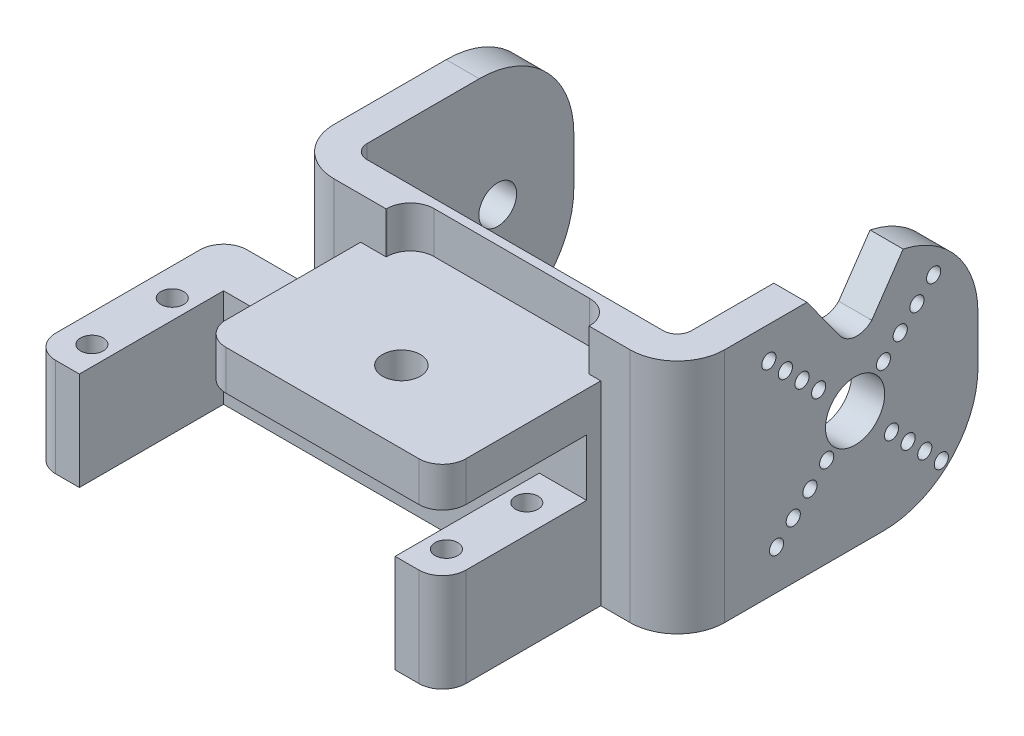
from build123d import *

# Parameters (mm, degrees)
BOSS_EXTRUDE1_DEPTH     = 50
BOSS_EXTRUDE2_DEPTH     = 20.8
SKETCH4_W               = 50.8
SKETCH4_H               = 3
BOSS_EXTRUDE3_DEPTH     = 20.4
BOSS_EXTRUDE4_START     = 32.8
BOSS_EXTRUDE4_OUTLINE_W = 50.8
BOSS_EXTRUDE4_OUTLINE_H = 30.5
BOSS_EXTRUDE4_OUTLINE_R = 4
BOSS_EXTRUDE4_DEPTH     = 8.4
CUT_EXTRUDE1_OUTLINE_R  = 2.4
CUT_EXTRUDE1_DEPTH      = 20.8
FILLET1_R               = 5
FILLET2_R               = 20
SKETCH6_R               = 1.5
CUT_EXTRUDE2_DEPTH      = 28.4
CUT_EXTRUDE3_DEPTH      = 136.4
CUT_EXTRUDE4_DEPTH      = 132.215666798
CUT_EXTRUDE4_DEPTH_BACK = 26.4
CUT_EXTRUDE5_DEPTH      = 8.8


# Read off the part's stored shape, not the designer's step: Boss-Extrude4, Cut-Extrude1
with BuildPart() as part:
    # Sketch1 → Boss-Extrude1 (new body)
    with BuildSketch(Plane(origin=(0, 0, 0), x_dir=(1, 0, 0), z_dir=(0, 1, 0))):
        with BuildLine():
            Line((-56.375697839, 54.197981352), (-56.375697839, 10.497981352))
            ThreePointArc((-56.375697839, 10.497981352), (-53.44676565, 3.42691354), (-46.375697839, 0.497981352))
            Line((-46.375697839, 0.497981352), (16.224302161, 0.497981352))
            ThreePointArc((16.224302161, 0.497981352), (23.295369973, 3.42691354), (26.224302161, 10.497981352))
            Line((26.224302161, 10.497981352), (26.224302161, 64.097981352))
            Line((26.224302161, 64.097981352), (19.224302161, 64.097981352))
            Line((19.224302161, 64.097981352), (19.224302161, 10.497981352))
            ThreePointArc((19.224302161, 10.497981352), (18.345622505, 8.376661008), (16.224302161, 7.497981352))
            Line((16.224302161, 7.497981352), (-46.375697839, 7.497981352))
            ThreePointArc((-46.375697839, 7.497981352), (-48.497018182, 8.376661008), (-49.375697839, 10.497981352))
            Line((-49.375697839, 10.497981352), (-49.375697839, 54.197981352))
            Line((-49.375697839, 54.197981352), (-56.375697839, 54.197981352))
        make_face()
    extrude(amount=BOSS_EXTRUDE1_DEPTH)

    # Sketch2 → Boss-Extrude2 (add)
    with BuildSketch(Plane.XZ):
        with BuildLine():
            Line((-71.775697839, -7.497981352), (-55.915089853, -7.497981352))
            ThreePointArc((-55.915089853, -7.497981352), (-52.291777622, -2.435723603), (-46.375697839, -0.497981352))
            Line((-46.375697839, -0.497981352), (10.024302161, -0.497981352))
            Line((10.024302161, -0.497981352), (10.024302161, 33.002018648))
            Line((10.024302161, 33.002018648), (0.024302161, 33.002018648))
            Line((0.024302161, 33.002018648), (0.024302161, 2.502018648))
            Line((0.024302161, 2.502018648), (-66.775697839, 2.502018648))
            Line((-66.775697839, 2.502018648), (-66.775697839, 33.002018648))
            Line((-66.775697839, 33.002018648), (-76.775697839, 33.002018648))
            Line((-76.775697839, 33.002018648), (-76.775697839, -2.497981352))
            ThreePointArc((-76.775697839, -2.497981352), (-75.311231744, -6.033515257), (-71.775697839, -7.497981352))
        make_face()
    extrude(amount=-BOSS_EXTRUDE2_DEPTH)

    # Sketch4 → Boss-Extrude3 (add)
    with BuildSketch(Plane(origin=(0, 20.8, 0), x_dir=(1, 0, 0), z_dir=(0, 1, 0))):
        with Locations((-15.375697839, -1.002018648)):
            Rectangle(SKETCH4_W, SKETCH4_H)
    extrude(amount=BOSS_EXTRUDE3_DEPTH)

    # Boss-Extrude4 outline → Boss-Extrude4 (add)
    with BuildSketch(Plane(origin=(0, 0, 0), x_dir=(1, 0, 0), z_dir=(0, 1, 0)).offset(BOSS_EXTRUDE4_START)):
        with Locations((-15.375697839, -17.752018648)):
            Rectangle(BOSS_EXTRUDE4_OUTLINE_W, BOSS_EXTRUDE4_OUTLINE_H)
        with Locations((-13.903425018, -17.753309847)):
            Circle(BOSS_EXTRUDE4_OUTLINE_R, mode=Mode.SUBTRACT)
    extrude(amount=BOSS_EXTRUDE4_DEPTH)

    # Cut-Extrude1 outline → Cut-Extrude1 (cut)
    with BuildSketch(Plane(origin=(0, 0, 0), x_dir=(1, 0, 0), z_dir=(0, 1, 0))):
        with Locations((-70.875697839, -9.252018648)):
            Circle(CUT_EXTRUDE1_OUTLINE_R)
        with Locations((-70.875697839, -26.252018648)):
            Circle(CUT_EXTRUDE1_OUTLINE_R)
        with Locations((4.124302161, -26.252018648)):
            Circle(CUT_EXTRUDE1_OUTLINE_R)
        with Locations((4.124302161, -9.252018648)):
            Circle(CUT_EXTRUDE1_OUTLINE_R)
    extrude(amount=CUT_EXTRUDE1_DEPTH, mode=Mode.SUBTRACT)

    # Fillet1
    fillet1_edges = [part.edges().sort_by_distance(p)[0] for p in [
        (-76.775697839, 10.4, 33.002018648),
        (10.024302161, 10.4, 33.002018648),
        (10.024302161, 37, 33.002018648),
        (-40.775697839, 37, 33.002018648),
    ]]
    fillet(fillet1_edges, radius=FILLET1_R)

    # Fillet2
    fillet2_edges = [part.edges().sort_by_distance(p)[0] for p in [
        (22.724302161, 0, -64.097981352),
        (-52.875697839, 0, -54.197981352),
        (22.724302161, 50, -64.097981352),
        (-52.875697839, 50, -54.197981352),
    ]]
    fillet(fillet2_edges, radius=FILLET2_R)

    # Sketch6 → Cut-Extrude2 (cut)
    with BuildSketch(Plane(origin=(26.224302161, 0, 0), x_dir=(0, 0, -1), z_dir=(1, 0, 0))):
        with BuildLine():
            ThreePointArc((34.097981352, 25), (38.097981352, 21), (42.097981352, 25))
            Line((42.097981352, 25), (34.097981352, 25))
        make_face()
        with BuildLine():
            Line((34.097981352, 25), (42.097981352, 25))
            ThreePointArc((42.097981352, 25), (38.097981352, 29), (34.097981352, 25))
        make_face()
        with BuildLine():
            ThreePointArc((31.836343923, 25), (38.097981352, 18.738362572), (44.35961878, 25))
            Line((44.35961878, 25), (42.097981352, 25))
            ThreePointArc((42.097981352, 25), (38.097981352, 21), (34.097981352, 25))
            Line((34.097981352, 25), (31.836343923, 25))
        make_face()
        with BuildLine():
            Line((42.097981352, 25), (44.35961878, 25))
            ThreePointArc((44.35961878, 25), (38.097981352, 31.261637428), (31.836343923, 25))
            Line((31.836343923, 25), (34.097981352, 25))
            ThreePointArc((34.097981352, 25), (38.097981352, 29), (42.097981352, 25))
        make_face()
        with Locations((30.390517437, 32.707463915)):
            Circle(SKETCH6_R)
        with Locations((26.876196734, 36.221784617)):
            Circle(SKETCH6_R)
        with Locations((23.354804964, 39.743176388)):
            Circle(SKETCH6_R)
        with Locations((19.854626397, 43.243354955)):
            Circle(SKETCH6_R)
        with Locations((44.108388992, 31.01040764)):
            Circle(SKETCH6_R)
        with Locations((47.643922898, 34.545941546)):
            Circle(SKETCH6_R)
        with Locations((51.179456803, 38.081475452)):
            Circle(SKETCH6_R)
        with Locations((54.714990709, 41.617009358)):
            Circle(SKETCH6_R)
        with Locations((45.805445266, 17.292536085)):
            Circle(SKETCH6_R)
        with Locations((49.319765969, 13.778215383)):
            Circle(SKETCH6_R)
        with Locations((52.841157739, 10.256823612)):
            Circle(SKETCH6_R)
        with Locations((56.341336306, 6.756645045)):
            Circle(SKETCH6_R)
        with Locations((32.087573711, 18.98959236)):
            Circle(SKETCH6_R)
        with Locations((28.552039805, 15.454058454)):
            Circle(SKETCH6_R)
        with Locations((25.0165059, 11.918524548)):
            Circle(SKETCH6_R)
        with Locations((21.480971994, 8.382990642)):
            Circle(SKETCH6_R)
    extrude(amount=-CUT_EXTRUDE2_DEPTH, mode=Mode.SUBTRACT)

    # Sketch6<3> → Cut-Extrude3 (cut)
    with BuildSketch(Plane(origin=(26.224302161, 0, 0), x_dir=(0, 0, -1), z_dir=(1, 0, 0))):
        with BuildLine():
            ThreePointArc((34.097981352, 25), (38.097981352, 21), (42.097981352, 25))
            Line((42.097981352, 25), (34.097981352, 25))
        make_face()
        with BuildLine():
            Line((34.097981352, 25), (42.097981352, 25))
            ThreePointArc((42.097981352, 25), (38.097981352, 29), (34.097981352, 25))
        make_face()
    extrude(amount=-CUT_EXTRUDE3_DEPTH, mode=Mode.SUBTRACT)

    # Sketch7 → Cut-Extrude4 (cut, two sides: drawn at the far end of the back side and taken through both)
    with BuildSketch(Plane(origin=(26.224302161, 0, 0), x_dir=(0, 0, -1), z_dir=(1, 0, 0)).offset(-CUT_EXTRUDE4_DEPTH_BACK)):
        with BuildLine():
            Line((44.097981352, 50), (27.901409821, 50))
            Line((27.901409821, 50), (34.889942889, 40.363586132))
            ThreePointArc((34.889942889, 40.363586132), (38.136702541, 38.542544558), (41.629478365, 39.830239282))
            Line((41.629478365, 39.830239282), (48.26230961, 49.561655609))
            ThreePointArc((48.26230961, 49.561655609), (46.191648926, 49.890112018), (44.097981352, 50))
        make_face()
    extrude(amount=CUT_EXTRUDE4_DEPTH + CUT_EXTRUDE4_DEPTH_BACK, mode=Mode.SUBTRACT)

    # Sketch8 → Cut-Extrude5 (cut)
    with BuildSketch(Plane(origin=(0, 50, 0), x_dir=(1, 0, 0), z_dir=(0, 1, 0))):
        with BuildLine():
            Line((-35.363310125, -41.134391508), (7.556460089, -41.134391508))
            Line((7.556460089, -41.134391508), (7.556460089, 0.627771813))
            ThreePointArc((7.556460089, 0.627771813), (6.091993995, 4.163305719), (2.556460089, 5.627771813))
            Line((2.556460089, 5.627771813), (-30.363310125, 5.627771813))
            ThreePointArc((-30.363310125, 5.627771813), (-33.898844031, 4.163305719), (-35.363310125, 0.627771813))
            Line((-35.363310125, 0.627771813), (-35.363310125, -41.134391508))
        make_face()
    extrude(amount=-CUT_EXTRUDE5_DEPTH, mode=Mode.SUBTRACT)


solid = part.part
